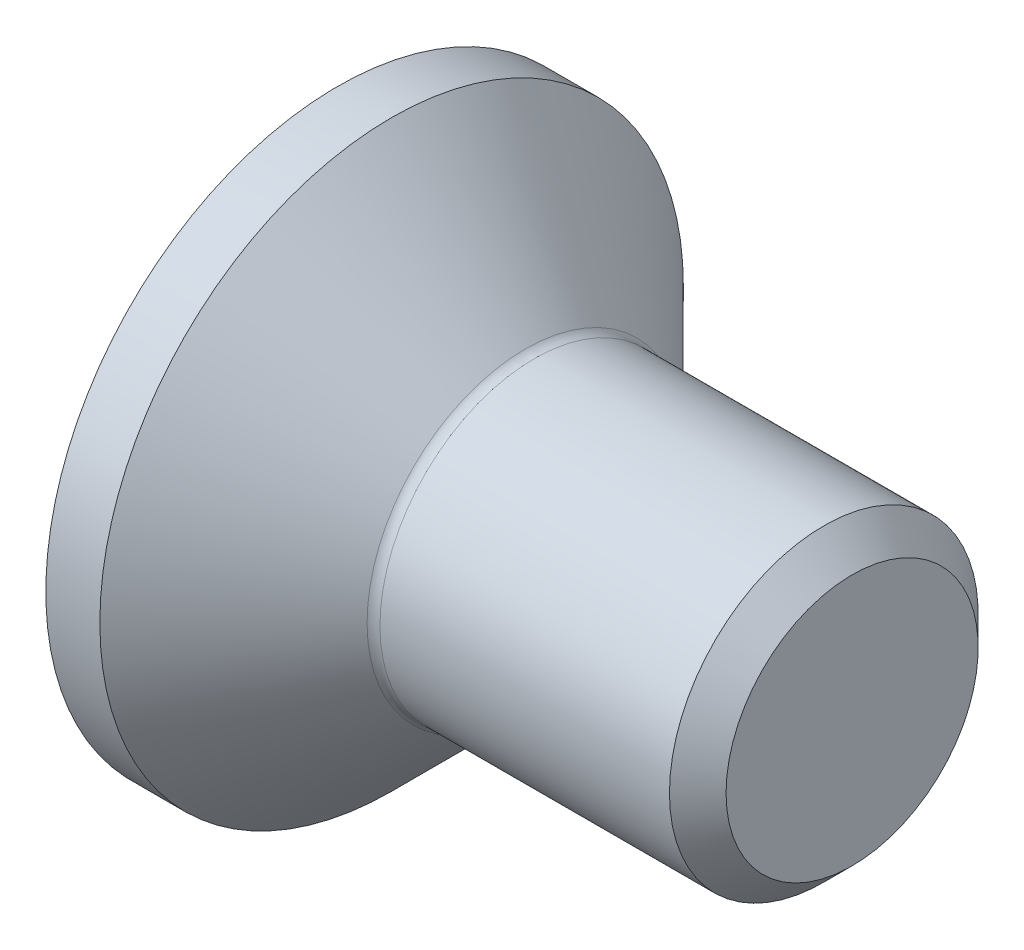
from build123d import *

# Parameters (mm, degrees)
HEXAGONSOCKET_DEPTH = 1.1
HEADFILLET_R        = 0.25
CHAMFER_2_SIZE      = 0.55
SKETCH4_W           = 5
SKETCH4_H           = 5


with BuildPart() as part:
    # Sketch1 → Base (revolve)
    with BuildSketch(Plane.XY):
        Polygon((0, 0), (0, 6.72), (3.72, 3), (10, 3), (10, 0), align=None)
    revolve(axis=Axis((-0.587069181, 0, 0), (1, 0, 0)))

    # Sketch2 → HexagonSocket (cut)
    with BuildSketch(Plane(origin=(0, 0, 0), x_dir=(0, 0, -1), z_dir=(1, 0, 0))):
        Polygon((2.309401077, 0), (1.154700538, 2), (-1.154700538, 2), (-2.309401077, 0), (-1.154700538, -2), (1.154700538, -2), align=None)
    extrude(amount=HEXAGONSOCKET_DEPTH, mode=Mode.SUBTRACT)

    # Sketch3 → Cut-Revolve1 (revolve, cut)
    with BuildSketch(Plane.XY):
        Polygon((1.1, 2), (2.254700538, 0), (1.1, 0), align=None)
    revolve(axis=Axis((-0.439109555, 0, 0), (1, 0, 0)), mode=Mode.SUBTRACT)

    # HeadFillet
    headfillet_edges = [part.edges().sort_by_distance(p)[0] for p in [
        (3.72, -3, 0),
    ]]
    fillet(headfillet_edges, radius=HEADFILLET_R)

    # Chamfer 2
    chamfer_2_edges = [part.edges().sort_by_distance(p)[0] for p in [
        (10, -3, 0),
    ]]
    chamfer(chamfer_2_edges, length=CHAMFER_2_SIZE)

    # Sketch4 → Cut-Revolve2 (revolve, cut)
    with BuildSketch(Plane(origin=(0, 0, 0), x_dir=(1, 0, 0), z_dir=(0, 1, 0))):
        with Locations((0.5, 8.17)):
            Rectangle(SKETCH4_W, SKETCH4_H)
    revolve(axis=Axis((11.853138686, 0, 0), (-1, 0, 0)), mode=Mode.SUBTRACT)


solid = part.part
